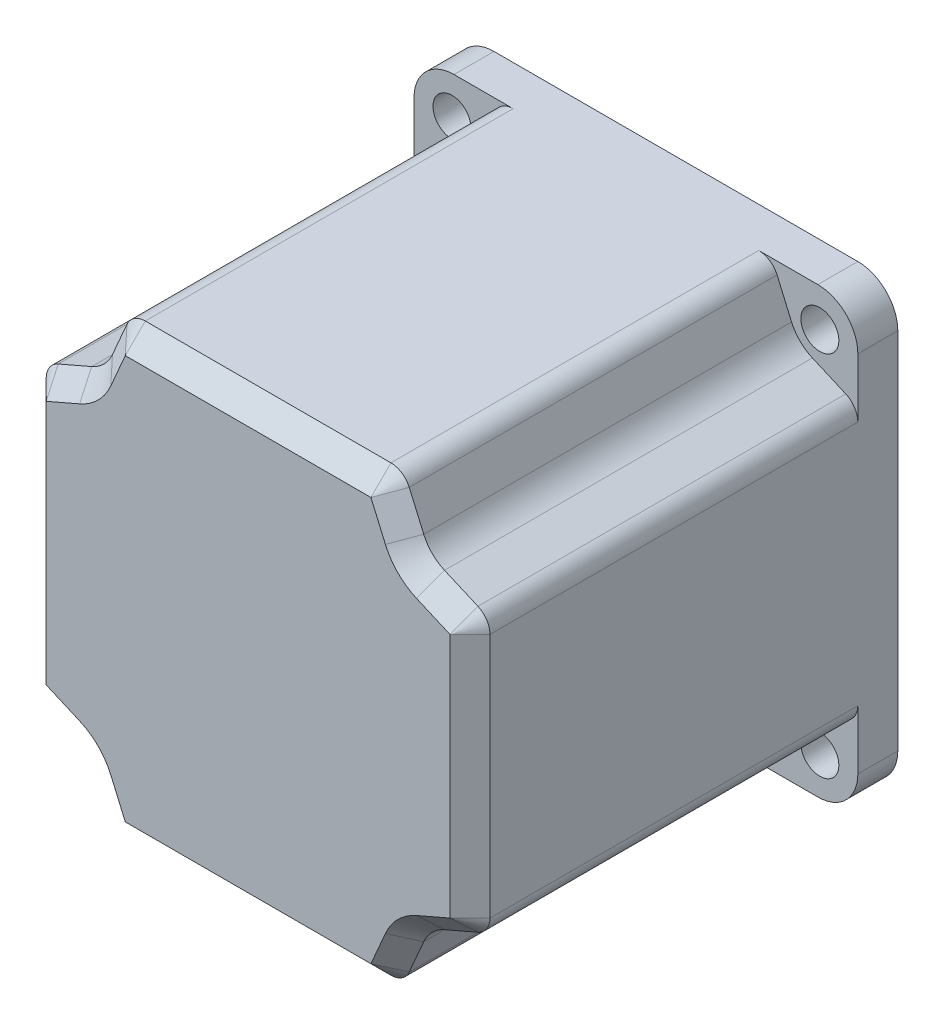
from build123d import *

# Parameters (mm, degrees)
SKETCH1_W           = 56.388
SKETCH1_H           = 56.388
BOSS_EXTRUDE1_DEPTH = 54.356
CUT_EXTRUDE1_DEPTH  = 49.276
FILLET2_R           = 5.08
FILLET3_R           = 2.54
SKETCH6_R           = 19.05
BOSS_EXTRUDE2_DEPTH = 1.524
BOSS_EXTRUDE3_DEPTH = 18.542
SKETCH10_R          = 2.413
CUT_EXTRUDE2_DEPTH  = 18.542
CHAMFER1_SIZE       = 0.508
CHAMFER2_SIZE       = 0.508
CHAMFER3_SIZE       = 2.54


with BuildPart() as part:
    # Sketch1 → Boss-Extrude1 (new body)
    with BuildSketch(Plane.XY):
        with Locations((28.194, -28.194)):
            Rectangle(SKETCH1_W, SKETCH1_H)
    extrude(amount=BOSS_EXTRUDE1_DEPTH)

    # Sketch3 → Cut-Extrude1 (cut)
    with BuildSketch(Plane.XY.offset(54.356)):
        Polygon((0, 0), (10.922, 0), (7.62, -7.62), (0, -10.922), align=None)
        Polygon((56.388, 0), (56.388, -10.922), (48.768, -7.62), (45.466, 0), align=None)
        Polygon((0, -56.388), (10.922, -56.388), (7.62, -48.768), (0, -45.466), align=None)
        Polygon((56.388, -56.388), (56.388, -45.466), (48.768, -48.768), (45.466, -56.388), align=None)
    extrude(amount=-CUT_EXTRUDE1_DEPTH, mode=Mode.SUBTRACT)

    # Fillet2
    fillet2_edges = [part.edges().sort_by_distance(p)[0] for p in [
        (0, 0, 2.54),
        (7.62, -7.62, 29.718),
        (56.388, 0, 2.54),
        (48.768, -7.62, 29.718),
        (0, -56.388, 2.54),
        (7.62, -48.768, 29.718),
        (56.388, -56.388, 2.54),
        (48.768, -48.768, 29.718),
    ]]
    fillet(fillet2_edges, radius=FILLET2_R)

    # Fillet3
    fillet3_edges = [part.edges().sort_by_distance(p)[0] for p in [
        (0, -10.922, 29.718),
        (10.922, 0, 29.718),
        (45.466, 0, 29.718),
        (56.388, -10.922, 29.718),
        (0, -45.466, 29.718),
        (10.922, -56.388, 29.718),
        (45.466, -56.388, 29.718),
        (56.388, -45.466, 29.718),
    ]]
    fillet(fillet3_edges, radius=FILLET3_R)

    # Sketch6 → Boss-Extrude2 (add)
    with BuildSketch(Plane(origin=(0, 0, 0), x_dir=(-1, 0, 0), z_dir=(0, 0, -1))):
        with Locations(Location((-28.194, -28.194, 0), (0, 0, 180))):
            Circle(SKETCH6_R)
    extrude(amount=BOSS_EXTRUDE2_DEPTH)

    # Sketch8 → Boss-Extrude3 (add)
    with BuildSketch(Plane(origin=(0, 0, -1.524), x_dir=(-1, 0, 0), z_dir=(0, 0, -1))):
        with BuildLine():
            Line((-30.861, -26.471288184), (-30.861, -29.916711816))
            ThreePointArc((-30.861, -29.916711816), (-25.019, -28.194), (-30.861, -26.471288184))
        make_face()
    extrude(amount=BOSS_EXTRUDE3_DEPTH)

    # Sketch10 → Cut-Extrude2 (cut)
    with BuildSketch(Plane(origin=(0, 0, 0), x_dir=(-1, 0, 0), z_dir=(0, 0, -1))):
        with Locations((-51.562, -4.826)):
            Circle(SKETCH10_R)
        with Locations((-4.826, -4.826)):
            Circle(SKETCH10_R)
        with Locations((-51.562, -51.562)):
            Circle(SKETCH10_R)
        with Locations((-4.826, -51.562)):
            Circle(SKETCH10_R)
    extrude(amount=-CUT_EXTRUDE2_DEPTH, mode=Mode.SUBTRACT)

    # Chamfer1
    chamfer1_edges = [part.edges().sort_by_distance(p)[0] for p in [
        (53.975, -4.826, 0),
        (7.239, -4.826, 0),
        (53.975, -51.562, 0),
        (7.239, -51.562, 0),
    ]]
    chamfer(chamfer1_edges, length=CHAMFER1_SIZE)

    # Chamfer2
    chamfer2_edges = [part.edges().sort_by_distance(p)[0] for p in [
        (25.019, -28.194, -20.066),
    ]]
    chamfer(chamfer2_edges, length=CHAMFER2_SIZE - 0.0001)  # a hair under: the kernel refuses the full size

    # Chamfer3
    chamfer3_edges = [part.edges().sort_by_distance(p)[0] for p in [
        (47.049244866, -3.653641998, 54.356),
        (52.734358002, -47.049244866, 54.356),
        (56.388, -28.194, 54.356),
        (28.194, 0, 54.356),
        (3.653641998, -9.338755134, 54.356),
        (0, -28.194, 54.356),
        (9.338755134, -52.734358002, 54.356),
        (28.194, -56.388, 54.356),
        (0.416700193, -11.19557153, 54.356),
        (11.19557153, -0.416700193, 54.356),
        (0.416700193, -45.19242847, 54.356),
        (11.19557153, -55.971299807, 54.356),
        (45.19242847, -55.971299807, 54.356),
        (55.971299807, -45.19242847, 54.356),
        (55.971299807, -11.19557153, 54.356),
        (45.19242847, -0.416700193, 54.356),
        (3.653641998, -47.049244866, 54.356),
        (47.049244866, -52.734358002, 54.356),
        (52.734358002, -9.338755134, 54.356),
        (9.338755134, -3.653641998, 54.356),
        (7.349463554, -49.038536446, 54.356),
        (49.038536446, -49.038536446, 54.356),
        (49.038536446, -7.349463554, 54.356),
        (7.349463554, -7.349463554, 54.356),
    ]]
    chamfer(chamfer3_edges, length=CHAMFER3_SIZE)


solid = part.part
